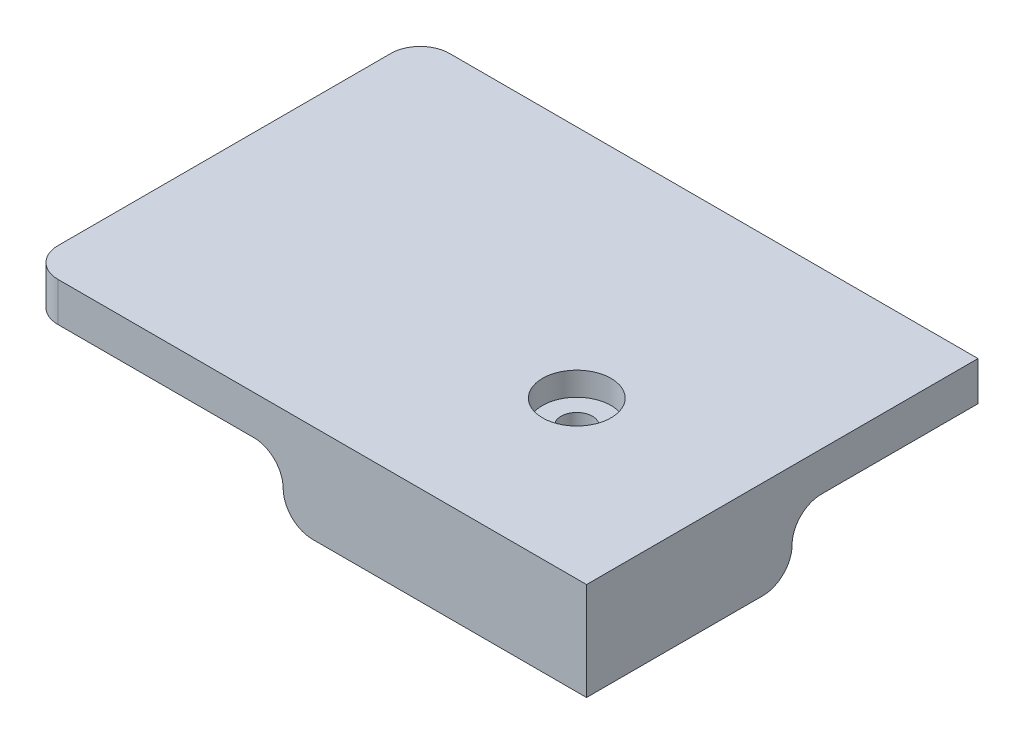
from build123d import *

# Parameters (mm, degrees)
SKETCH1_W                                = 57
SKETCH1_H                                = 40
BOSS_EXTRUDE1_DEPTH                      = 4
SKETCH2_W                                = 31
SKETCH2_H                                = 21
BOSS_EXTRUDE2_DEPTH                      = 6
CBORE_FOR_M3_PAN_HEAD_SCREW1_D           = 3.2
CBORE_FOR_M3_PAN_HEAD_SCREW1_CBORE_D     = 7
CBORE_FOR_M3_PAN_HEAD_SCREW1_CBORE_DEPTH = 2.4
FILLET1_R                                = 3


with BuildPart() as part:
    # Sketch1 → Boss-Extrude1 (new body)
    with BuildSketch(Plane(origin=(0, 0, 0), x_dir=(1, 0, 0), z_dir=(0, 1, 0))):
        Rectangle(SKETCH1_W, SKETCH1_H)
    extrude(amount=-BOSS_EXTRUDE1_DEPTH)

    # Sketch2 → Boss-Extrude2 (add)
    with BuildSketch(Plane.XZ.offset(4)):
        with Locations((13, 9.5)):
            Rectangle(SKETCH2_W, SKETCH2_H)
    extrude(amount=BOSS_EXTRUDE2_DEPTH)

    # CBORE for M3 Pan Head Screw1 (through all)
    with Locations(Plane(origin=(0, 0, 0), x_dir=(1, 0, 0), z_dir=(0, 1, 0))):
        with Locations((11.5, -4)):
            CounterBoreHole(CBORE_FOR_M3_PAN_HEAD_SCREW1_D / 2, CBORE_FOR_M3_PAN_HEAD_SCREW1_CBORE_D / 2, CBORE_FOR_M3_PAN_HEAD_SCREW1_CBORE_DEPTH)

    # Fillet1
    fillet1_edges = [part.edges().sort_by_distance(p)[0] for p in [
        (13, -10, -1),
        (-2.5, -10, 9.5),
        (13, -4, -1),
        (-2.5, -4, 9.5),
        (-28.5, -2, 20),
        (-28.5, -2, -20),
    ]]
    fillet(fillet1_edges, radius=FILLET1_R - 0.0001)  # a hair under: the kernel refuses the full size


solid = part.part
